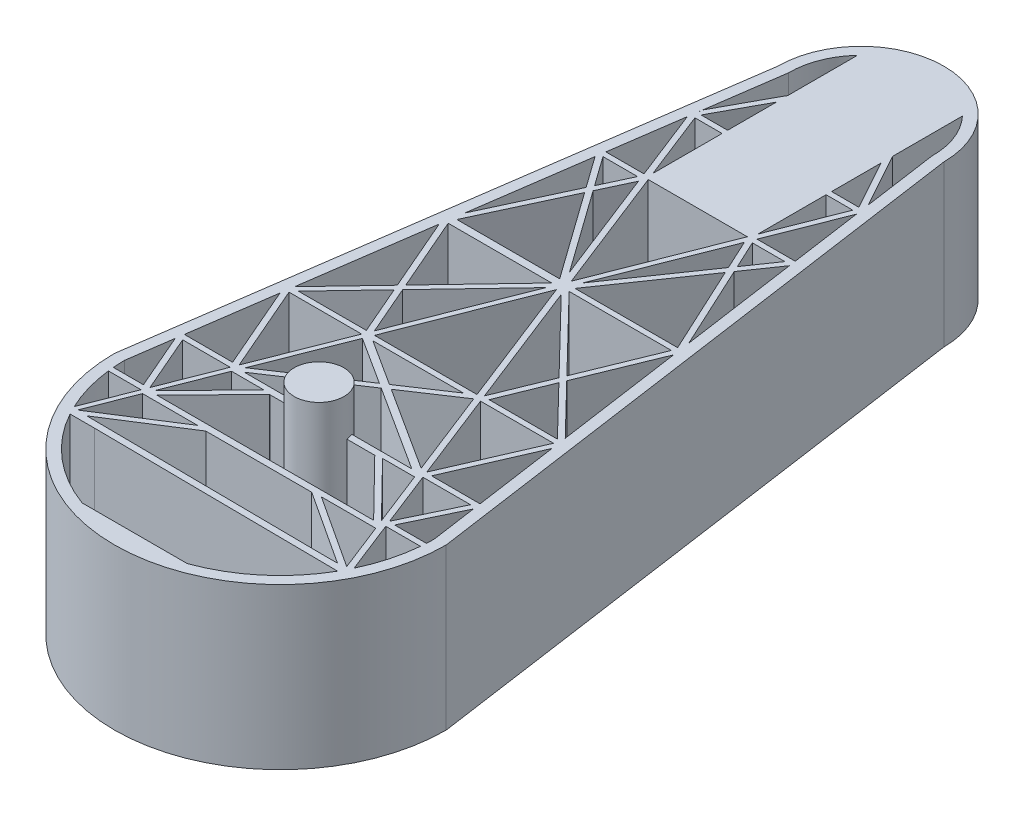
from build123d import *

# Parameters (mm, degrees)
BOSS_EXTRUDE1_DEPTH  = 29
SKETCH3_W            = 13
SKETCH3_H            = 24
CUT_EXTRUDE1_DEPTH   = 27
SKETCH12_W           = 13
SKETCH12_H           = 5
CUT_EXTRUDE5_DEPTH   = 10
SKETCH17_W           = 13
SKETCH17_H           = 23
CUT_EXTRUDE6_DEPTH   = 27
SKETCH18_W           = 13
SKETCH18_H           = 5.5
CUT_EXTRUDE7_DEPTH   = 10
SKETCH19_W           = 11
SKETCH19_H           = 22
BOSS_EXTRUDE13_DEPTH = 26.9
SKETCH20_W           = 0.5
SKETCH20_H           = 1
SKETCH20_W_2         = 1
SKETCH20_H_2         = 0.5
BOSS_EXTRUDE14_DEPTH = 4
CUT_EXTRUDE8_DEPTH   = 27
SKETCH28_W           = 11
SKETCH28_H           = 22
CUT_EXTRUDE9_DEPTH   = 26.9
BOSS_EXTRUDE18_DEPTH = 27
BOSS_EXTRUDE19_DEPTH = 27
RIB1_START           = -27
RIB1_DEPTH           = 27
RIB2_START           = -27
RIB2_DEPTH           = 27
RIB3_START           = -27
RIB3_DEPTH           = 27
RIB4_REACH           = 129.047
RIB5_START           = -27
RIB5_DEPTH           = 27
RIB6_REACH           = 129.047
RIB7_START           = -27
RIB7_DEPTH           = 27
SKETCH39_W           = 13
SKETCH39_H           = 24
BOSS_EXTRUDE20_DEPTH = 27
SKETCH40_W           = 13
SKETCH40_H           = 5
BOSS_EXTRUDE21_DEPTH = 10
SKETCH41_W           = 19
SKETCH41_H           = 53.339134382
CUT_EXTRUDE10_DEPTH  = 27
BOSS_EXTRUDE22_DEPTH = 27
RIB8_REACH           = 129.047
RIB9_START           = -27
RIB9_DEPTH           = 27
RIB10_REACH          = 129.047
BOSS_EXTRUDE24_START = -4
BOSS_EXTRUDE24_DEPTH = 2
CUT_EXTRUDE11_DEPTH  = 3.5
SKETCH48_R           = 4.5
BOSS_EXTRUDE25_DEPTH = 32
CUT_EXTRUDE12_DEPTH  = 3.5
SKETCH51_W           = 12.5
SKETCH51_H           = 12.146846377
CUT_EXTRUDE13_DEPTH  = 10


# Read off the part's stored shape, not the designer's step: Rib1, Rib2, Rib3, Rib5, Rib7, Rib9
with BuildPart() as part:
    # Sketch1 → Boss-Extrude1 (new body)
    # profile 1 of 4: a face of its own
    with BuildSketch(Plane(origin=(0, 0, 0), x_dir=(1, 0, 0), z_dir=(0, 1, 0))):
        with BuildLine():
            Line((-15, 105), (-30, 0))
            ThreePointArc((-30, 0), (0, -30), (30, 0))
            Line((30, 0), (15, 105))
            ThreePointArc((15, 105), (0, 120), (-15, 105))
        make_face()
        with BuildLine():
            ThreePointArc((-6.5, -2), (-8.5, 0), (-6.5, 2))
            Line((-6.5, 2), (-3.5, 2))
            Line((-3.5, 2), (-2, 17))
            ThreePointArc((-2, 17), (0, 19), (2, 17))
            Line((2, 17), (3.5, 2))
            Line((3.5, 2), (6.5, 2))
            ThreePointArc((6.5, 2), (8.5, 0), (6.5, -2))
            Line((6.5, -2), (3, -2))
            Line((3, -2), (2, -14))
            ThreePointArc((2, -14), (0, -16), (-2, -14))
            Line((-2, -14), (-3, -2))
            Line((-3, -2), (-6.5, -2))
        make_face(mode=Mode.SUBTRACT)
    # profile 2 of 4: a face of its own
    with BuildSketch(Plane(origin=(0, 0, 0), x_dir=(1, 0, 0), z_dir=(0, 1, 0))):
        with BuildLine():
            Line((-2, 17), (-3.5, 2))
            Line((-3.5, 2), (3.5, 2))
            Line((3.5, 2), (2, 17))
            ThreePointArc((2, 17), (0, 19), (-2, 17))
        make_face()
    # profile 3 of 4: a face of its own
    with BuildSketch(Plane(origin=(0, 0, 0), x_dir=(1, 0, 0), z_dir=(0, 1, 0))):
        with BuildLine():
            Line((3, -2), (-3, -2))
            Line((-3, -2), (-2, -14))
            ThreePointArc((-2, -14), (0, -16), (2, -14))
            Line((2, -14), (3, -2))
        make_face()
    # profile 4 of 4: a face of its own
    with BuildSketch(Plane(origin=(0, 0, 0), x_dir=(1, 0, 0), z_dir=(0, 1, 0))):
        with BuildLine():
            ThreePointArc((6.5, 2), (8.5, 0), (6.5, -2))
            Line((6.5, -2), (-6.5, -2))
            ThreePointArc((-6.5, -2), (-8.5, 0), (-6.5, 2))
            Line((-6.5, 2), (6.5, 2))
        make_face()
    extrude(amount=BOSS_EXTRUDE1_DEPTH)

    # Sketch3 → Cut-Extrude1 (cut)
    with BuildSketch(Plane(origin=(0, 0, 0), x_dir=(-1, 0, 0), z_dir=(0, -1, 0))):
        with Locations((0, 7)):
            Rectangle(SKETCH3_W, SKETCH3_H)
    extrude(amount=-CUT_EXTRUDE1_DEPTH, mode=Mode.SUBTRACT)

    # Sketch12 → Cut-Extrude5 (cut)
    with BuildSketch(Plane(origin=(0, 0, 0), x_dir=(-1, 0, 0), z_dir=(0, -1, 0))):
        with Locations((0, 21.5)):
            Rectangle(SKETCH12_W, SKETCH12_H)
        with Locations((0, -7.5)):
            Rectangle(SKETCH12_W, SKETCH12_H)
    extrude(amount=-CUT_EXTRUDE5_DEPTH, mode=Mode.SUBTRACT)

    # Sketch17 → Cut-Extrude6 (cut)
    with BuildSketch(Plane(origin=(0, 0, 0), x_dir=(-1, 0, 0), z_dir=(0, -1, 0))):
        with Locations((0, 95.5)):
            Rectangle(SKETCH17_W, SKETCH17_H)
    extrude(amount=-CUT_EXTRUDE6_DEPTH, mode=Mode.SUBTRACT)

    # Sketch18 → Cut-Extrude7 (cut)
    with BuildSketch(Plane(origin=(0, 0, 0), x_dir=(-1, 0, 0), z_dir=(0, -1, 0))):
        with Locations((0, 109.75)):
            Rectangle(SKETCH18_W, SKETCH18_H)
        with Locations((0, 81.25)):
            Rectangle(SKETCH18_W, SKETCH18_H)
    extrude(amount=-CUT_EXTRUDE7_DEPTH, mode=Mode.SUBTRACT)

    # Sketch19 → Boss-Extrude13 (add)
    with BuildSketch(Plane(origin=(0, 27, 0), x_dir=(-1, 0, 0), z_dir=(0, -1, 0))):
        with Locations((-0.5, 95.5)):
            Rectangle(SKETCH19_W, SKETCH19_H)
    extrude(amount=BOSS_EXTRUDE13_DEPTH)

    # Sketch20 → Boss-Extrude14 (add)
    with BuildSketch(Plane(origin=(0, 0, 0), x_dir=(-1, 0, 0), z_dir=(0, -1, 0))):
        with Locations((-6.25, 99.5)):
            Rectangle(SKETCH20_W, SKETCH20_H)
        with Locations((-6.25, 91.5)):
            Rectangle(SKETCH20_W, SKETCH20_H)
        with Locations((6.25, 91.5)):
            Rectangle(SKETCH20_W, SKETCH20_H)
        with Locations((6.25, 99.5)):
            Rectangle(SKETCH20_W, SKETCH20_H)
        with Locations((-3, 112.25)):
            Rectangle(SKETCH20_W_2, SKETCH20_H_2)
        with Locations((3, 112.25)):
            Rectangle(SKETCH20_W_2, SKETCH20_H_2)
        with Locations((3, 78.75)):
            Rectangle(SKETCH20_W_2, SKETCH20_H_2)
        with Locations((-3, 78.75)):
            Rectangle(SKETCH20_W_2, SKETCH20_H_2)
    extrude(amount=-BOSS_EXTRUDE14_DEPTH)

    # Sketch24 → Cut-Extrude8 (cut)
    with BuildSketch(Plane(origin=(0, 29, 0), x_dir=(1, 0, 0), z_dir=(0, 1, 0))):
        with BuildLine():
            Line((-9.5, 27), (-24.122552054, 27))
            Line((-24.122552054, 27), (-27.999651515, -0.139696229))
            ThreePointArc((-27.999651515, -0.139696229), (-22.872660663, -16.150584948), (-9.5, -26.339134382))
            Line((-9.5, -26.339134382), (-9.5, 27))
        make_face()
        with BuildLine():
            Line((27.999651515, -0.139696229), (24.122552054, 27))
            Line((24.122552054, 27), (9.5, 27))
            Line((9.5, 27), (9.5, -26.339134382))
            ThreePointArc((9.5, -26.339134382), (22.872660663, -16.150584948), (27.999651515, -0.139696229))
        make_face()
        Polygon((9.5, 75.5), (-9.5, 75.5), (-17.193980625, 75.5), (-24.122552054, 27), (-9.5, 27), (9.5, 27), (24.122552054, 27), (17.193980625, 75.5), align=None)
        with BuildLine():
            Line((-9.5, 75.5), (-9.5, 113.874119675))
            ThreePointArc((-9.5, 113.874119675), (-12.118365581, 109.705870339), (-12.999277287, 104.862923364))
            Line((-12.999277287, 104.862923364), (-17.193980625, 75.5))
            Line((-17.193980625, 75.5), (-9.5, 75.5))
        make_face()
        with BuildLine():
            ThreePointArc((12.999277287, 104.862923364), (12.118365581, 109.705870339), (9.5, 113.874119675))
            Line((9.5, 113.874119675), (9.5, 75.5))
            Line((9.5, 75.5), (17.193980625, 75.5))
            Line((17.193980625, 75.5), (12.999277287, 104.862923364))
        make_face()
    extrude(amount=-CUT_EXTRUDE8_DEPTH, mode=Mode.SUBTRACT)

    # Sketch28 → Cut-Extrude9 (cut)
    with BuildSketch(Plane.XZ.offset(-0.1)):
        with Locations((0.5, -95.5)):
            Rectangle(SKETCH28_W, SKETCH28_H)
    extrude(amount=-CUT_EXTRUDE9_DEPTH, mode=Mode.SUBTRACT)

    # Sketch29 → Boss-Extrude18 (add)
    with BuildSketch(Plane(origin=(0, 29, 0), x_dir=(1, 0, 0), z_dir=(0, 1, 0))):
        with BuildLine():
            Line((-9.5, 90.391770921), (-14.297026496, 90.391770921))
            Line((-14.297026496, 90.391770921), (-9.5, 99.214423292))
            Line((-9.5, 99.214423292), (-9.5, 101.222789323))
            Line((-9.5, 101.222789323), (-9.93926824, 100.499997149))
            Line((-9.93926824, 100.499997149), (-14.923190235, 91.333608088))
            Line((-14.923190235, 91.333608088), (-14.990053023, 90.884842357))
            Line((-14.990053023, 90.884842357), (-15.063517034, 90.391770921))
            Line((-15.063517034, 90.391770921), (-15.138013351, 89.891770921))
            Line((-15.138013351, 89.891770921), (-15.28150885, 88.887302424))
            Line((-15.28150885, 88.887302424), (-10.232874911, 76))
            Line((-10.232874911, 76), (-17.122552054, 76))
            Line((-17.122552054, 76), (-17.265409197, 75))
            Line((-17.265409197, 75), (-17.193980625, 75))
            Line((-17.193980625, 75), (-9.841122334, 75))
            Line((-9.841122334, 75), (-0.805497934, 51.935379821))
            Line((-0.805497934, 51.935379821), (-20.560354937, 51.935379821))
            Line((-20.560354937, 51.935379821), (-20.756177742, 50.564620179))
            Line((-20.756177742, 50.564620179), (-0.805497934, 50.564620179))
            Line((-0.805497934, 50.564620179), (-25.307597563, -11.980213086))
            ThreePointArc((-25.307597563, -11.980213086), (-25.056539784, -12.496792151), (-24.794938956, -13.008112936))
            Line((-24.794938956, -13.008112936), (-9.5, 25.87966887))
            Line((-9.5, 25.87966887), (-9.5, 27))
            Line((-9.5, 27), (-9.059362981, 27))
            Line((-9.059362981, 27), (-0.030308513, 49.956606827))
            Line((-0.030308513, 49.956606827), (8.963001378, 27))
            Line((8.963001378, 27), (9.5, 27))
            Line((9.5, 27), (9.5, 25.629240359))
            Line((9.5, 25.629240359), (24.544087834, -12.772773323))
            Line((24.544087834, -12.772773323), (24.69990286, -13.187676017))
            ThreePointArc((24.69990286, -13.187676017), (25.01103789, -12.587612311), (25.307597563, -11.980213086))
            Line((25.307597563, -11.980213086), (0.507755163, 51.324647778))
            Line((0.507755163, 51.324647778), (15.28150885, 88.887302424))
            Line((15.28150885, 88.887302424), (14.994517851, 90.896239419))
            Line((14.994517851, 90.896239419), (14.672462808, 90.074151546))
            Line((14.672462808, 90.074151546), (9.5, 76.870759641))
            Line((9.5, 76.870759641), (9.5, 75.5))
            Line((9.5, 75.5), (8.963001378, 75.5))
            Line((8.963001378, 75.5), (0, 52.620759641))
            Line((0, 52.620759641), (-8.963001378, 75.5))
            Line((-8.963001378, 75.5), (-9.5, 75.5))
            Line((-9.5, 75.5), (-9.5, 76))
            Line((-9.5, 76), (-9.5, 76.870759641))
            Line((-9.5, 76.870759641), (-14.40513844, 89.391770921))
            Line((-14.40513844, 89.391770921), (-9.5, 89.391770921))
            Line((-9.5, 89.391770921), (-9.5, 90.391770921))
        make_face()
    extrude(amount=-BOSS_EXTRUDE18_DEPTH)

    # Sketch30 → Boss-Extrude19 (add)
    with BuildSketch(Plane(origin=(0, 29, 0), x_dir=(1, 0, 0), z_dir=(0, 1, 0))):
        Polygon((-23.117040578, 26.37966887), (-1.288799548, 49.330929217), (-0.805497934, 50.564620179), (-1.495522022, 50.564620179), (-24.160632794, 26.733434816), (-24.35402793, 25.37966887), (-10.671767519, 25.37966887), (-10.280014942, 26.37966887), align=None)
        Polygon((-17.36866851, 74.283947798), (-13.345369668, 68.64625886), (-20.33411146, 53.60855225), (-20.560354937, 51.935379821), (-20.008995126, 51.935379821), (-12.67755367, 67.710474814), (-1.419763091, 51.935379821), (-0.805497934, 51.935379821), (-1.550000267, 53.839366761), (-12.193031336, 68.753023661), (-9.588937256, 74.356264406), (-9.841122334, 75), (-10.392482144, 75), (-12.860847335, 69.688807707), (-16.651144039, 75), (-17.265409197, 75), align=None)
    extrude(amount=-BOSS_EXTRUDE19_DEPTH)

    # Rib1 outline → Rib1 (add)
    with BuildSketch(Plane(origin=(0, 29, 0), x_dir=(1, 0, 0), z_dir=(0, 1, 0)).offset(RIB1_START)):
        Polygon((-13.92271626, 36.047022773), (-14.671476771, 35.259740034), (-10.824908299, 26.37966887), (-10.280014942, 26.37966887), (-10.021246748, 27.040208733), align=None)
        Polygon((-20.756177742, 50.564620179), (-20.891313891, 49.618667133), (-15.103334294, 36.256713199), (-14.354573784, 37.043995938), (-20.211284385, 50.564620179), align=None)
    extrude(amount=RIB1_DEPTH)

    # Rib2 outline → Rib2 (add)
    with BuildSketch(Plane(origin=(0, 29, 0), x_dir=(1, 0, 0), z_dir=(0, 1, 0)).offset(RIB2_START)):
        Polygon((-16.412589495, 8.304229518), (-16.416798823, 8.293527194), (-16.407953584, 8.293527194), align=None)
        Polygon((-20.945140647, -3.288239782), (-20.959228104, -3.255717905), (-20.972019272, -3.288239782), align=None)
        with BuildLine():
            Line((-21.447850137, -2.127699919), (-25.961999056, 8.293527194))
            Line((-25.961999056, 8.293527194), (-17.365307557, 8.293527194))
            Line((-17.365307557, 8.293527194), (-16.910663074, 9.454067057))
            Line((-16.910663074, 9.454067057), (-23.809134572, 25.37966887))
            Line((-23.809134572, 25.37966887), (-24.35402793, 25.37966887))
            Line((-24.35402793, 25.37966887), (-24.48916408, 24.433715823))
            Line((-24.48916408, 24.433715823), (-17.930908952, 9.293527194))
            Line((-17.930908952, 9.293527194), (-26.652048169, 9.293527194))
            Line((-26.652048169, 9.293527194), (-26.85861289, 7.847574147))
            Line((-26.85861289, 7.847574147), (-22.468096015, -2.288239782))
            Line((-22.468096015, -2.288239782), (-27.906342625, -2.288239782))
            ThreePointArc((-27.906342625, -2.288239782), (-27.860782728, -2.788688898), (-27.806248922, -3.288239782))
            Line((-27.806248922, -3.288239782), (-21.90249462, -3.288239782))
            Line((-21.90249462, -3.288239782), (-21.447850137, -2.127699919))
        make_face()
    extrude(amount=RIB2_DEPTH)

    # Rib3 outline → Rib3 (add)
    with BuildSketch(Plane(origin=(0, 29, 0), x_dir=(1, 0, 0), z_dir=(0, 1, 0)).offset(RIB3_START)):
        Polygon((-22.15968752, -3.755717905), (-22.085630379, -3.755717905), (-22.037313418, -3.632382504), align=None)
        with BuildLine():
            Line((-21.155882918, -3.755717905), (-11.214169645, -3.755717905))
            Line((-11.214169645, -3.755717905), (-24.483640873, -12.216629429))
            Line((-24.483640873, -12.216629429), (-24.794938956, -13.008112936))
            ThreePointArc((-24.794938956, -13.008112936), (-24.661799941, -13.2587942), (-24.526126578, -13.508112936))
            Line((-24.526126578, -13.508112936), (-9.5, -13.508112936))
            Line((-9.5, -13.508112936), (-9.5, -12.508112936))
            Line((-9.5, -12.508112936), (-23.080769311, -12.508112936))
            Line((-23.080769311, -12.508112936), (-9.5, -3.848710795))
            Line((-9.5, -3.848710795), (-9.5, -2.755717905))
            Line((-9.5, -2.755717905), (-19.758768689, -2.755717905))
            Line((-19.758768689, -2.755717905), (-9.5, 7.583637671))
            Line((-9.5, 7.583637671), (-9.5, 8.793527194))
            Line((-9.5, 8.793527194), (-16.220144009, 8.793527194))
            Line((-16.220144009, 8.793527194), (-16.412589495, 8.304229518))
            Line((-16.412589495, 8.304229518), (-16.407953584, 8.293527194))
            Line((-16.407953584, 8.293527194), (-16.416798823, 8.293527194))
            Line((-16.416798823, 8.293527194), (-16.613453636, 7.793527194))
            Line((-16.613453636, 7.793527194), (-10.700459416, 7.793527194))
            Line((-10.700459416, 7.793527194), (-20.496660128, -2.079626743))
            Line((-20.496660128, -2.079626743), (-20.959228104, -3.255717905))
            Line((-20.959228104, -3.255717905), (-20.945140647, -3.288239782))
            Line((-20.945140647, -3.288239782), (-20.972019272, -3.288239782))
            Line((-20.972019272, -3.288239782), (-21.155882918, -3.755717905))
        make_face()
    extrude(amount=RIB3_DEPTH)

    # Sketch35 walls → Rib4 (add, up to next)
    with BuildSketch(Plane(origin=(0, 29, 0), x_dir=(1, 0, 0), z_dir=(0, 1, 0)), mode=Mode.PRIVATE) as rib4_sk1:
        Polygon((-118.031081383, 75), (16.241336661, 75), (-0.444888801, 50.824647778), (19.903867634, 50.824647778), (9.634386219, 25.629240359), (152.294181599, 25.629240359), (152.294181599, 26.629240359), (11.121855694, 26.629240359), (21.391337109, 51.824647778), (1.460399127, 51.824647778), (18.146624589, 76), (-118.031081383, 76), align=None)
    rib4_tool1 = extrude(rib4_sk1.sketch, amount=-RIB4_REACH, mode=Mode.PRIVATE) - part.part
    add(rib4_tool1.solids().sort_by_distance((10.577678767, 29, -51.324647778))[0])

    # Rib5 outline → Rib5 (add)
    with BuildSketch(Plane(origin=(0, 29, 0), x_dir=(1, 0, 0), z_dir=(0, 1, 0)).offset(RIB5_START)):
        Polygon((14.777721867, 35.598635596), (23.478903096, 26.629240359), (24.175517717, 26.629240359), (24.055218383, 27.471335694), (15.189912537, 36.609914692), align=None)
        Polygon((1.175496792, 49.62014941), (14.017330063, 36.382466485), (14.429520734, 37.393745581), (1.400246072, 50.824647778), (0.703631452, 50.824647778), align=None)
        with BuildLine():
            Line((21.609833869, -2.541184708), (27.884446924, -2.541184708))
            ThreePointArc((27.884446924, -2.541184708), (27.925476341, -2.04151197), (27.957552641, -1.541184708))
            Line((27.957552641, -1.541184708), (22.207378361, -1.541184708))
            Line((22.207378361, -1.541184708), (26.821744615, 8.105652071))
            Line((26.821744615, 8.105652071), (26.622851229, 9.497905775))
            Line((26.622851229, 9.497905775), (17.851887019, 9.497905775))
            Line((17.851887019, 9.497905775), (24.453235093, 24.685218728))
            Line((24.453235093, 24.685218728), (24.31837486, 25.629240359))
            Line((24.31837486, 25.629240359), (23.773184281, 25.629240359))
            Line((23.773184281, 25.629240359), (16.830923948, 9.657611669))
            Line((16.830923948, 9.657611669), (17.285241721, 8.497905775))
            Line((17.285241721, 8.497905775), (25.900859019, 8.497905775))
            Line((25.900859019, 8.497905775), (21.164404979, -1.404168859))
            Line((21.164404979, -1.404168859), (21.609833869, -2.541184708))
        make_face()
    extrude(amount=RIB5_DEPTH)

    # Sketch37 walls → Rib6 (add, up to next)
    with BuildSketch(Plane(origin=(0, 29, 0), x_dir=(1, 0, 0), z_dir=(0, 1, 0)), mode=Mode.PRIVATE) as rib6_sk1:
        Polygon((144.338545622, 8.793527194), (8.310112804, 8.793527194), (19.62586965, -2.755717905), (7.82072297, -2.755717905), (23.02062583, -12.687676017), (-118.54723531, -12.687676017), (-118.54723531, -13.687676017), (26.37917989, -13.687676017), (11.17927703, -3.755717905), (22.005644041, -3.755717905), (10.689887196, 7.793527194), (144.338545622, 7.793527194), align=None)
    rib6_tool1 = extrude(rib6_sk1.sketch, amount=-RIB6_REACH, mode=Mode.PRIVATE) - part.part
    add(rib6_tool1.solids().sort_by_distance((15.157878423, 29, 3.255717905))[0])

    # Rib7 outline → Rib7 (add)
    with BuildSketch(Plane(origin=(0, 29, 0), x_dir=(1, 0, 0), z_dir=(0, 1, 0)).offset(RIB7_START)):
        Polygon((14.994517851, 90.896239419), (14.925359414, 91.380348477), (9.5, 101.193377242), (9.5, 99.126612499), (14.433743019, 90.202786726), (9.5, 90.202786726), (9.5, 89.202786726), (14.331103394, 89.202786726), align=None)
        Polygon((12.560541043, 67.9067654), (20.024941405, 51.824647778), (20.5761738, 51.824647778), (20.331072707, 53.540355429), (13.219728619, 68.861810137), align=None)
        Polygon((9.566651282, 74.357127781), (12.071987114, 68.959359229), (12.73117469, 69.914403967), (10.370731509, 75), (9.819499114, 75), align=None)
    extrude(amount=RIB7_DEPTH)

    # Sketch39 → Boss-Extrude20 (add)
    with BuildSketch(Plane.XZ.offset(-27)):
        with Locations((0, -7)):
            Rectangle(SKETCH39_W, SKETCH39_H)
    extrude(amount=BOSS_EXTRUDE20_DEPTH)

    # Sketch40 → Boss-Extrude21 (add)
    with BuildSketch(Plane.XZ.offset(-10)):
        with Locations((0, 7.5)):
            Rectangle(SKETCH40_W, SKETCH40_H)
        with Locations((0, -21.5)):
            Rectangle(SKETCH40_W, SKETCH40_H)
    extrude(amount=BOSS_EXTRUDE21_DEPTH)

    # Sketch41 → Cut-Extrude10 (cut)
    with BuildSketch(Plane(origin=(0, 29, 0), x_dir=(1, 0, 0), z_dir=(0, 1, 0))):
        with Locations((0, 0.330432809)):
            Rectangle(SKETCH41_W, SKETCH41_H)
    extrude(amount=-CUT_EXTRUDE10_DEPTH, mode=Mode.SUBTRACT)

    # Sketch42 → Boss-Extrude22 (add)
    with BuildSketch(Plane(origin=(0, 29, 0), x_dir=(1, 0, 0), z_dir=(0, 1, 0))):
        Polygon((-9.5, 25.87966887), (-9.059362981, 27), (-9.5, 27), align=None)
        Polygon((9.5, 25.629240359), (8.963001378, 27), (9.5, 27), align=None)
    extrude(amount=-BOSS_EXTRUDE22_DEPTH)

    # Sketch43 walls → Rib8 (add, up to next)
    with BuildSketch(Plane(origin=(0, 29, 0), x_dir=(1, 0, 0), z_dir=(0, 1, 0)), mode=Mode.PRIVATE) as rib8_sk1:
        Polygon((-137.56209021, 25.341899899), (7.761848095, 25.341899899), (-123.120933054, -61.694526916), (-122.567196771, -62.527219013), (11.071532059, 26.341899899), (-137.56209021, 26.341899899), align=None)
    rib8_tool1 = extrude(rib8_sk1.sketch, amount=-RIB8_REACH, mode=Mode.PRIVATE) - part.part
    add(rib8_tool1.solids().sort_by_distance((-3.401726966, 29, -17.317713546))[0])

    # Rib9 outline → Rib9 (add)
    with BuildSketch(Plane(origin=(0, 29, 0), x_dir=(1, 0, 0), z_dir=(0, 1, 0)).offset(RIB9_START)):
        Polygon((-0.442207028, 18.68531818), (14.983895464, 8.793527194), (16.095434023, 8.793527194), (15.722533536, 9.745404752), (0.649114635, 19.411041894), align=None)
        Polygon((9.5, 7.586307582), (9.5, 8.78630759), (-9.5, 8.788582437), (-9.5, 7.588582428), align=None)
        Polygon((-9.935383103, 24.772695958), (-1.361587101, 19.274858896), (-0.270265437, 20.000582611), (-8.599971154, 25.341899899), (-9.711509713, 25.341899899), align=None)
    extrude(amount=RIB9_DEPTH)

    # Sketch45 walls → Rib10 (add, up to next)
    with BuildSketch(Plane(origin=(0, 29, 0), x_dir=(1, 0, 0), z_dir=(0, 1, 0)), mode=Mode.PRIVATE) as rib10_sk1:
        Polygon((-137.547302146, -3.887777158), (137.547166847, -3.918793765), (137.547302146, -2.718793772), (-137.547166847, -2.687777166), align=None)
    rib10_tool1 = extrude(rib10_sk1.sketch, amount=-RIB10_REACH, mode=Mode.PRIVATE) - part.part
    # Sketch45 walls → Rib10 (add, up to next)
    with BuildSketch(Plane(origin=(0, 29, 0), x_dir=(1, 0, 0), z_dir=(0, 1, 0)), mode=Mode.PRIVATE) as rib10_sk2:
        Polygon((-137.547187551, -12.398005654), (137.535847231, -14.997729713), (137.547187551, -13.797783299), (-137.535847231, -11.19805924), align=None)
    rib10_tool2 = extrude(rib10_sk2.sketch, amount=-RIB10_REACH, mode=Mode.PRIVATE) - part.part
    add(rib10_tool1.solids().sort_by_distance((0, 29, 3.303285465))[0])
    add(rib10_tool2.solids().sort_by_distance((0, 29, 13.097894476))[0])

    # Sketch46 → Boss-Extrude24 (add)
    with BuildSketch(Plane.XZ.offset(BOSS_EXTRUDE24_START)):
        with BuildLine():
            Line((27.999651515, 0.139696229), (17.193980625, -75.5))
            Line((17.193980625, -75.5), (-17.193980625, -75.5))
            Line((-17.193980625, -75.5), (-27.999651515, 0.139696229))
            ThreePointArc((-27.999651515, 0.139696229), (0, 28), (27.999651515, 0.139696229))
        make_face()
    extrude(amount=BOSS_EXTRUDE24_DEPTH)

    # Sketch47 → Cut-Extrude11 (cut)
    with BuildSketch(Plane.XZ):
        with BuildLine():
            Line((-2.61, 10.028693798), (-4.89, -2.949024809))
            ThreePointArc((-4.89, -2.949024809), (-6.35, -7), (-4.89, -11.050975191))
            Line((-4.89, -11.050975191), (-2.61, -24.028693798))
            ThreePointArc((-2.61, -24.028693798), (0, -26.22), (2.61, -24.028693798))
            Line((2.61, -24.028693798), (4.89, -11.050975191))
            ThreePointArc((4.89, -11.050975191), (6.35, -7), (4.89, -2.949024809))
            Line((4.89, -2.949024809), (2.61, 10.028693798))
            ThreePointArc((2.61, 10.028693798), (0, 12.22), (-2.61, 10.028693798))
        make_face()
    extrude(amount=-CUT_EXTRUDE11_DEPTH, mode=Mode.SUBTRACT)

    # Sketch48 → Boss-Extrude25 (add)
    with BuildSketch(Plane(origin=(0, 4, 0), x_dir=(1, 0, 0), z_dir=(0, 1, 0))):
        with Locations(Location((0, 7, 0), (0, 0, 156.58926247))):
            Circle(SKETCH48_R)
    extrude(amount=BOSS_EXTRUDE25_DEPTH)

    # Sketch50 → Cut-Extrude12 (cut)
    with BuildSketch(Plane.XZ):
        with BuildLine():
            Line((-5.360001963, -11.26531112), (-3.102455306, -24.115225701))
            ThreePointArc((-3.102455306, -24.115225701), (1e-09, -26.719999998), (3.102455308, -24.115225701))
            Line((3.102455308, -24.115225701), (5.360001964, -11.265311119))
            ThreePointArc((5.360001964, -11.265311119), (6.85, -7), (5.360001964, -2.73468888))
            Line((5.360001964, -2.73468888), (3.102455307, 10.115225701))
            ThreePointArc((3.102455307, 10.115225701), (0, 12.719999998), (-3.102455307, 10.115225701))
            Line((-3.102455307, 10.115225701), (-5.360001964, -2.73468888))
            ThreePointArc((-5.360001964, -2.73468888), (-6.85, -7), (-5.360001963, -11.26531112))
        make_face()
    extrude(amount=-CUT_EXTRUDE12_DEPTH, mode=Mode.SUBTRACT)

    # Sketch51 → Cut-Extrude13 (cut)
    with BuildSketch(Plane.XZ):
        with Locations((0, -95.878964786)):
            Rectangle(SKETCH51_W, SKETCH51_H)
    extrude(amount=-CUT_EXTRUDE13_DEPTH, mode=Mode.SUBTRACT)


solid = part.part
